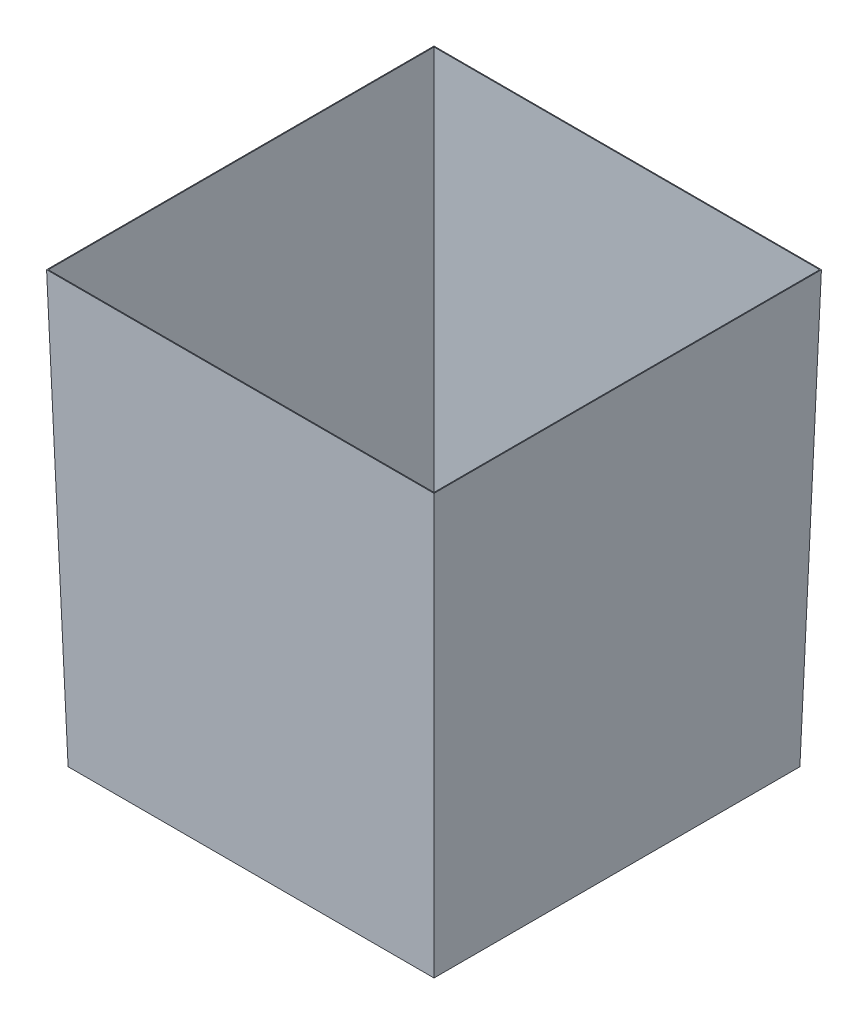
from build123d import *

# Parameters (mm, degrees)
SHELL_2_T = -2


with BuildPart() as part:
    # Эскиз1 → Корпус 850-900, H1000 section 0
    with BuildSketch(Plane(origin=(0, 0, 0), x_dir=(1, 0, 0), z_dir=(0, 1, 0))):
        with BuildLine():
            Line((-425, -425), (425, -425))
            Line((425, -425), (425, 425))
            Line((425, 425), (-425, 425))
            Line((-425, 425), (-425, -425))
        make_face()
    # Эскиз2 → Корпус 850-900, H1000 section 1
    with BuildSketch(Plane(origin=(0, 1000, 0), x_dir=(1, 0, 0), z_dir=(0, 1, 0))):
        with BuildLine():
            Line((-450, -450), (450, -450))
            Line((450, -450), (450, 450))
            Line((450, 450), (-450, 450))
            Line((-450, 450), (-450, -450))
        make_face()
    loft()

    # Стенка и дно 2 мм
    shell_2_openings = [part.faces().sort_by_distance(p)[0] for p in [
        (0, 1000, 0),
    ]]
    offset(amount=SHELL_2_T, openings=shell_2_openings, kind=Kind.INTERSECTION)


solid = part.part
